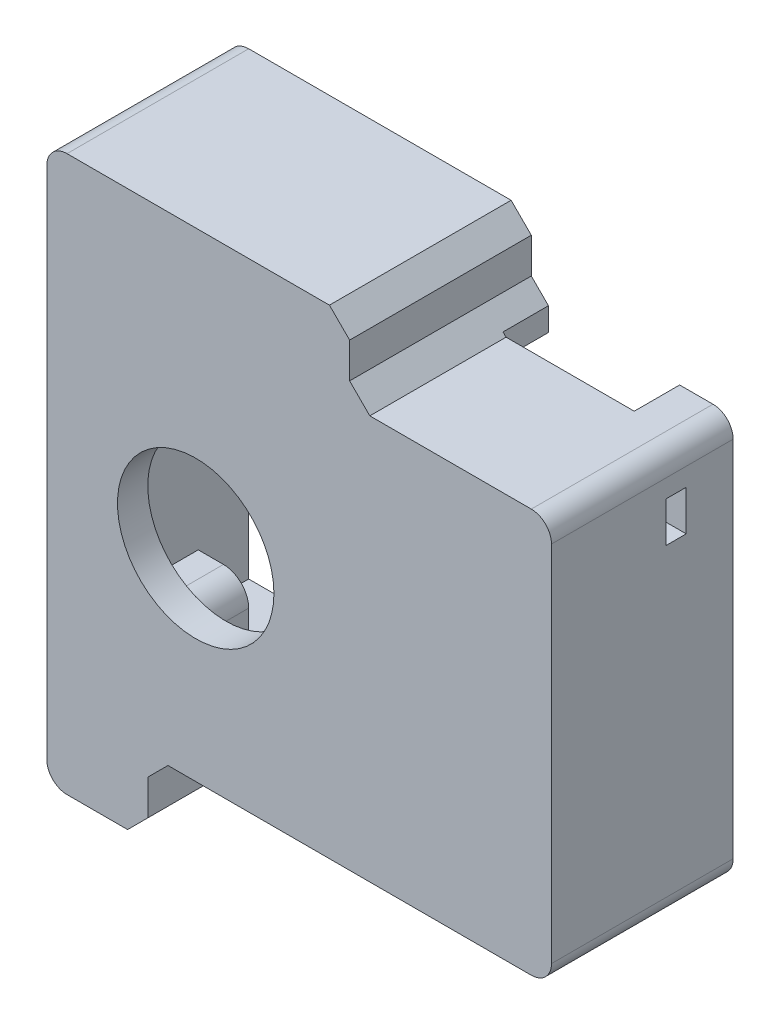
from build123d import *

# Parameters (mm, degrees)
SKETCH1_W           = 46
SKETCH1_H           = 36
BOSS_EXTRUDE1_DEPTH = 15
BOSS_EXTRUDE2_DEPTH = 3
SKETCH3_R           = 7.75
CUT_EXTRUDE1_DEPTH  = 10
SKETCH4_W           = 5
SKETCH4_H           = 5
SKETCH4_R           = 1
BOSS_EXTRUDE3_DEPTH = 10
FILLET1_R           = 2.5
SKETCH6_R           = 1
CUT_EXTRUDE2_DEPTH  = 10
CHAMFER1_SIZE       = 2
FILLET2_R           = 2
SKETCH7_W           = 13
SKETCH7_H           = 4.5
CUT_EXTRUDE3_DEPTH  = 10
SKETCH8_W           = 9
SKETCH8_H           = 4
CUT_EXTRUDE4_DEPTH  = 10
SKETCH9_W           = 2
SKETCH9_H           = 4
CUT_EXTRUDE5_DEPTH  = 10


with BuildPart() as part:
    # Sketch1 → Boss-Extrude1 (new body)
    with BuildSketch(Plane.XY):
        Polygon((-15, -27.5), (-15, -20), (25, -20), (25, 20), (5, 20), (5, 27.5), (-25, 27.5), (-25, -27.5), align=None)
        Rectangle(SKETCH1_W, SKETCH1_H, mode=Mode.SUBTRACT)
    extrude(amount=BOSS_EXTRUDE1_DEPTH)

    # Sketch2 → Boss-Extrude2 (add)
    with BuildSketch(Plane.XY.offset(15)):
        Polygon((-25, 27.5), (-25, -27.5), (-15, -27.5), (-15, -20), (25, -20), (25, 20), (5, 20), (5, 27.5), align=None)
    extrude(amount=BOSS_EXTRUDE2_DEPTH)

    # Sketch3 → Cut-Extrude1 (cut)
    with BuildSketch(Plane.XY.offset(18)):
        with Locations((-10.25, 0)):
            Circle(SKETCH3_R)
    extrude(amount=-CUT_EXTRUDE1_DEPTH, mode=Mode.SUBTRACT)

    # Sketch4 → Boss-Extrude3 (add)
    # profile 1 of 4: a face of its own
    with BuildSketch(Plane(origin=(0, 0, 15), x_dir=(-1, 0, 0), z_dir=(0, 0, -1))):
        with Locations((20.5, -15.5)):
            Rectangle(SKETCH4_W, SKETCH4_H)
        with Locations((20.252039878, -15.196246514)):
            Circle(SKETCH4_R, mode=Mode.SUBTRACT)
    # profile 2 of 4: a face of its own
    with BuildSketch(Plane(origin=(0, 0, 15), x_dir=(-1, 0, 0), z_dir=(0, 0, -1))):
        with Locations((-3.747960122, -15.5)):
            Rectangle(SKETCH4_W, SKETCH4_H)
        with Locations((-3.747960122, -15.196246514)):
            Circle(SKETCH4_R, mode=Mode.SUBTRACT)
    # profile 3 of 4: a face of its own
    with BuildSketch(Plane(origin=(0, 0, 15), x_dir=(-1, 0, 0), z_dir=(0, 0, -1))):
        with Locations((-3.747960122, 15.5)):
            Rectangle(SKETCH4_W, SKETCH4_H)
        with Locations((-3.747960122, 15.203753486)):
            Circle(SKETCH4_R, mode=Mode.SUBTRACT)
    # profile 4 of 4: a face of its own
    with BuildSketch(Plane(origin=(0, 0, 15), x_dir=(-1, 0, 0), z_dir=(0, 0, -1))):
        with Locations((20.5, 15.5)):
            Rectangle(SKETCH4_W, SKETCH4_H)
        with Locations((20.252039878, 15.203753486)):
            Circle(SKETCH4_R, mode=Mode.SUBTRACT)
    extrude(amount=BOSS_EXTRUDE3_DEPTH)

    # Fillet1
    fillet1_edges = [part.edges().sort_by_distance(p)[0] for p in [
        (1.247960122, 13, 10),
        (6.247960122, 13, 10),
        (-18, 13, 10),
        (-18, -13, 10),
        (1.247960122, -13, 10),
        (6.247960122, -13, 10),
    ]]
    fillet(fillet1_edges, radius=FILLET1_R - 0.0001)  # a hair under: the kernel refuses the full size

    # Sketch6 → Cut-Extrude2 (cut)
    with BuildSketch(Plane(origin=(0, 0, -3), x_dir=(-1, 0, 0), z_dir=(0, 0, -1))):
        with Locations((0, 22.5)):
            Circle(SKETCH6_R)
        with Locations((20, 22.5)):
            Circle(SKETCH6_R)
        with Locations((20, -22.5)):
            Circle(SKETCH6_R)
    extrude(amount=-CUT_EXTRUDE2_DEPTH, mode=Mode.SUBTRACT)

    # Chamfer1
    chamfer1_edges = [part.edges().sort_by_distance(p)[0] for p in [
        (5, 27.5, 9),
        (5, 20, 9),
        (-15, -20, 9),
        (-15, -27.5, 9),
    ]]
    chamfer(chamfer1_edges, length=CHAMFER1_SIZE)

    # Fillet2
    fillet2_edges = [part.edges().sort_by_distance(p)[0] for p in [
        (-25, 27.5, 9),
        (25, 20, 9),
        (25, -20, 9),
        (-25, -27.5, 9),
    ]]
    fillet(fillet2_edges, radius=FILLET2_R)

    # Sketch7 → Cut-Extrude3 (cut)
    with BuildSketch(Plane.XZ.offset(-18)):
        with Locations((13.2, 2.25)):
            Rectangle(SKETCH7_W, SKETCH7_H)
    extrude(amount=-CUT_EXTRUDE3_DEPTH, mode=Mode.SUBTRACT)

    # Sketch8 → Cut-Extrude4 (cut)
    with BuildSketch(Plane(origin=(0, -18, 0), x_dir=(1, 0, 0), z_dir=(0, 1, 0))):
        Polygon((22.2, 0), (9.2, 0), (9.2, -4.5), (11.7, -4.5), (11.7, -9.5), (22.2, -9.5), align=None)
        with Locations((-3.8, -6.2)):
            Rectangle(SKETCH8_W, SKETCH8_H)
    extrude(amount=-CUT_EXTRUDE4_DEPTH, mode=Mode.SUBTRACT)

    # Sketch9 → Cut-Extrude5 (cut)
    with BuildSketch(Plane.ZY.offset(-23)):
        with Locations((5.65, 14.2)):
            Rectangle(SKETCH9_W, SKETCH9_H)
    extrude(amount=-CUT_EXTRUDE5_DEPTH, mode=Mode.SUBTRACT)


solid = part.part
